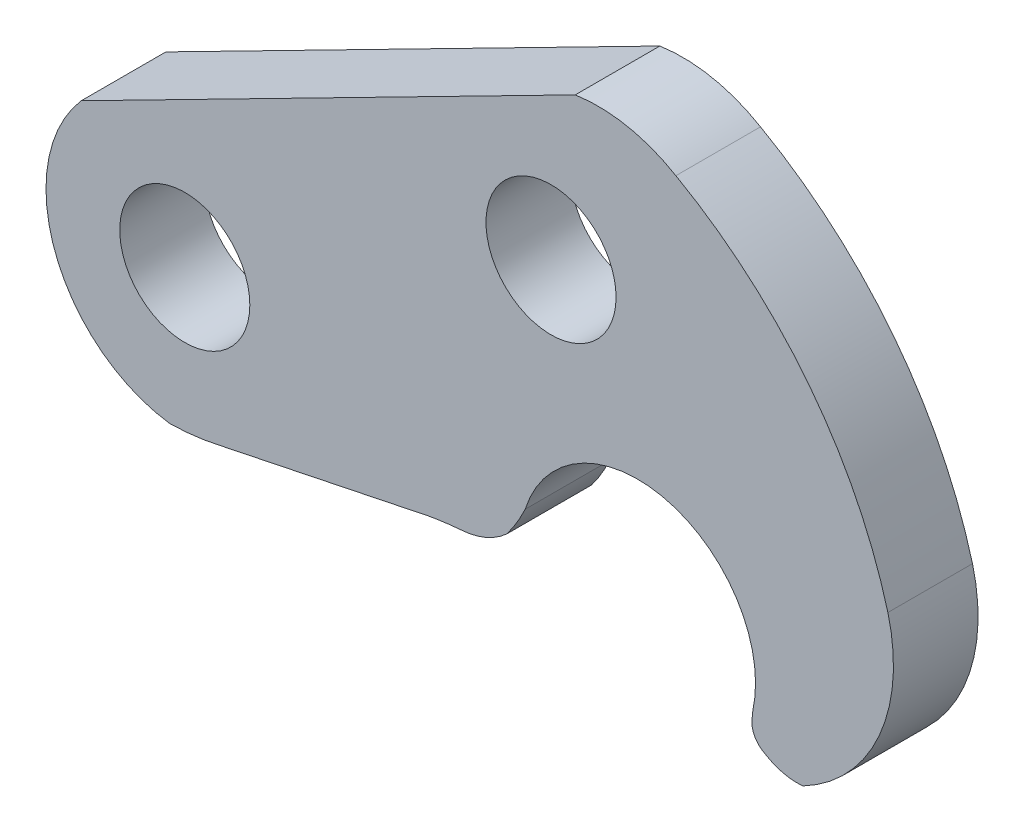
from build123d import *

# Parameters (mm, degrees)
IZIM1_R            = 30.75
TABAN_FLAN_1_DEPTH = 40


# Sheet-metal steps are written as plain solids
with BuildPart() as part:
    # Çizim1 → Taban-Flanş1 (new body)
    with BuildSketch(Plane.XY):
        with BuildLine():
            Line((-1.643398768, 91.658785331), (231.87468677, 210.823863864))
            ThreePointArc((231.87468677, 210.823863864), (256.473387586, 210.2990154), (279.460662471, 201.526516265))
            ThreePointArc((279.460662471, 201.526516265), (342.491227066, 147.22978074), (379.677674371, 72.810994814))
            ThreePointArc((379.677674371, 72.810994814), (375.525370831, 20.220941214), (339.489037745, -18.306166907))
            ThreePointArc((339.489037745, -18.306166907), (330.00144074, -17.604735784), (321.25415431, -13.864216747))
            ThreePointArc((321.25415431, -13.864216747), (316.568149269, -9.137053114), (315.500028304, -2.567134022))
            Line((315.500028304, -2.567134022), (315.804951466, 0.498028518))
            ThreePointArc((315.804951466, 0.498028518), (275.813280207, 66.354649224), (208.223919967, 29.366723581))
            ThreePointArc((208.223919967, 29.366723581), (204.280862876, 21.941440766), (199.589645635, 14.964693321))
            ThreePointArc((199.589645635, 14.964693321), (189.567794587, 8.489124316), (177.959719616, 5.728130318))
            ThreePointArc((177.959719616, 5.728130318), (170.039190968, 4.902214912), (162.171757217, 3.669171324))
            Line((162.171757217, 3.669171324), (63.894243865, -16.687773846))
            ThreePointArc((63.894243865, -16.687773846), (52.087429233, -18.756679073), (40.128679606, -19.57493818))
            ThreePointArc((40.128679606, -19.57493818), (-13.999894405, 23.558211566), (-1.643398768, 91.658785331))
        make_face()
        with Locations((47.296813478, 47.891327559)):
            Circle(IZIM1_R, mode=Mode.SUBTRACT)
        with Locations((220.432800905, 137.607155914)):
            Circle(IZIM1_R, mode=Mode.SUBTRACT)
    extrude(amount=-TABAN_FLAN_1_DEPTH)


solid = part.part
